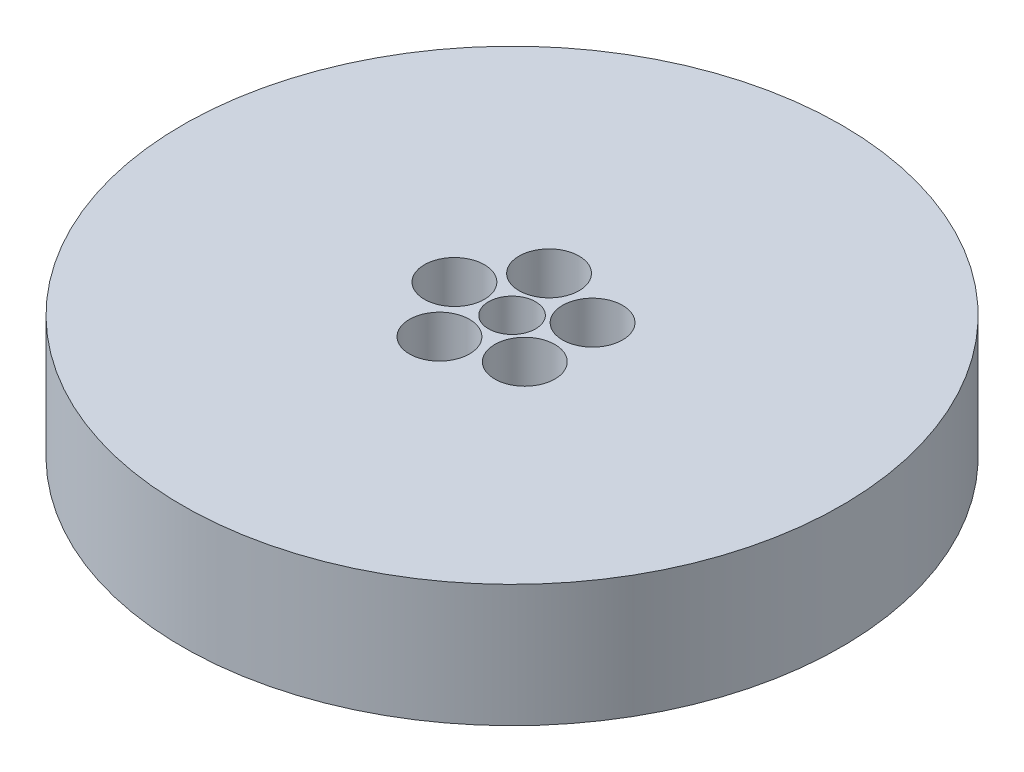
from build123d import *

# Parameters (mm, degrees)
SKETCH1_R           = 70
BOSS_EXTRUDE1_DEPTH = 26
SKETCH2_R           = 5
CUT_EXTRUDE1_DEPTH  = 103.352332655
SKETCH3_R           = 6.378055708
CUT_EXTRUDE2_DEPTH  = 16.120715999
CIRPATTERN1_COUNT   = 5


with BuildPart() as part:
    # Sketch1 → Boss-Extrude1 (new body)
    with BuildSketch(Plane(origin=(0, 0, 0), x_dir=(1, 0, 0), z_dir=(0, 1, 0))):
        Circle(SKETCH1_R)
    extrude(amount=BOSS_EXTRUDE1_DEPTH)

    # Sketch2 → Cut-Extrude1 (cut, through all)
    with BuildSketch(Plane(origin=(0, 0, 0), x_dir=(1, 0, 0), z_dir=(0, 1, 0))):
        Circle(SKETCH2_R)
    extrude(amount=CUT_EXTRUDE1_DEPTH, mode=Mode.SUBTRACT)

    # Sketch3 → Cut-Extrude2 (cut)
    with BuildSketch(Plane(origin=(0, 26, 0), x_dir=(1, 0, 0), z_dir=(0, 1, 0))):
        with Locations((-12.2390453, 0)):
            Circle(SKETCH3_R)
    cut_extrude2 = extrude(amount=-CUT_EXTRUDE2_DEPTH, mode=Mode.SUBTRACT)

    # CirPattern1: Cut-Extrude2 ×5 about axis
    cirpattern1_axis = Axis((0, 0, 0), (0, 1, 0))
    for i in range(1, CIRPATTERN1_COUNT):
        add(cut_extrude2.rotate(cirpattern1_axis, i * 360 / CIRPATTERN1_COUNT), mode=Mode.SUBTRACT)


solid = part.part
